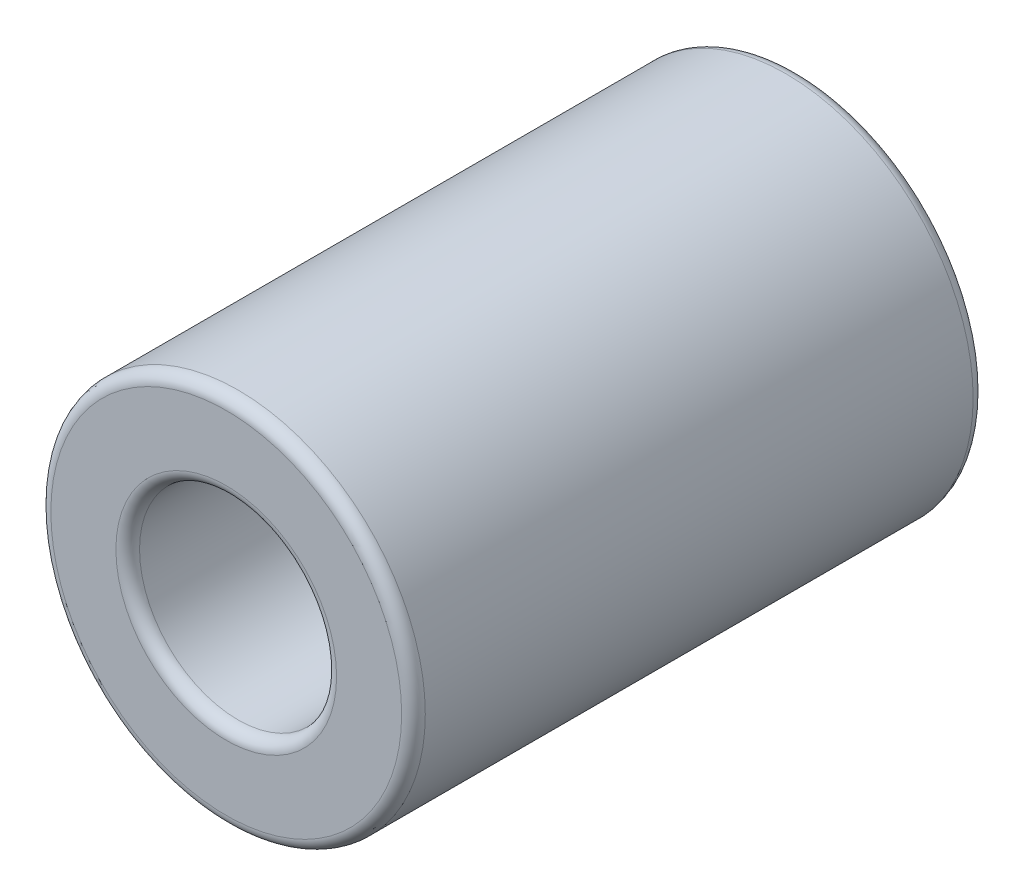
from build123d import *

# Parameters (mm, degrees)
ESQUISSE1_R        = 9.5
ESQUISSE1_R_2      = 5
BOSS_EXTRU_1_DEPTH = 29
CONG_1_R           = 0.6


with BuildPart() as part:
    # Esquisse1 → Boss.-Extru.1 (new body)
    with BuildSketch(Plane.XY):
        Circle(ESQUISSE1_R)
        Circle(ESQUISSE1_R_2, mode=Mode.SUBTRACT)
    extrude(amount=BOSS_EXTRU_1_DEPTH)

    # Congé1
    cong_1_edges = [part.edges().sort_by_distance(p)[0] for p in [
        (-5, 0, 29),
        (-5, 0, 0),
        (-9.5, 0, 0),
        (-9.5, 0, 29),
    ]]
    fillet(cong_1_edges, radius=CONG_1_R)


solid = part.part
